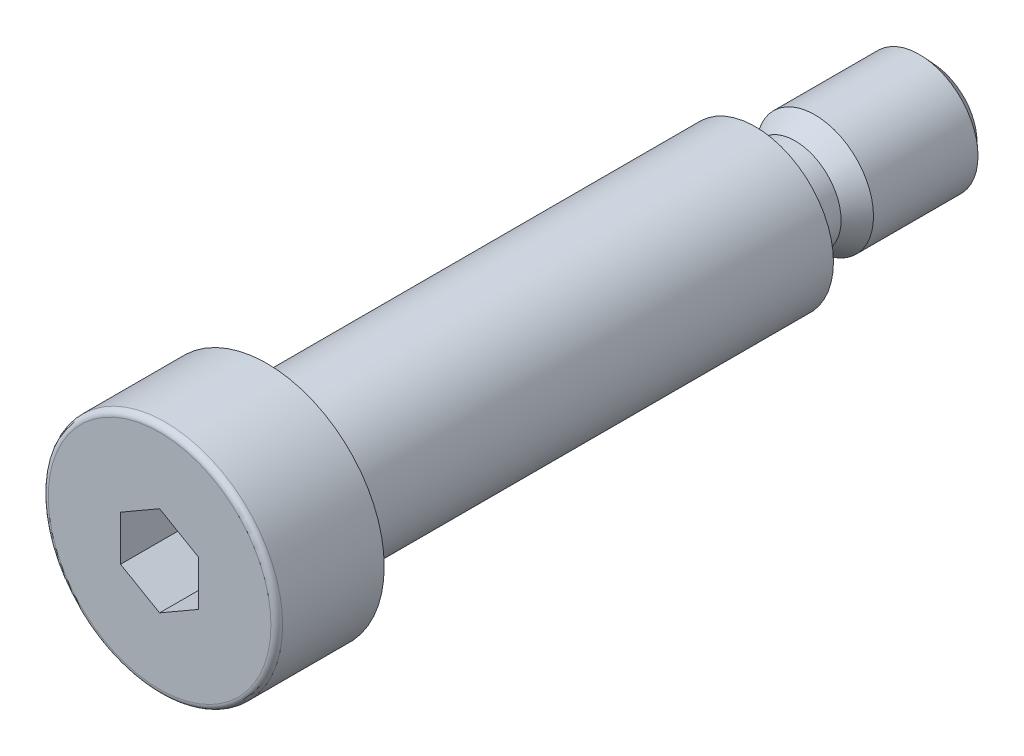
from build123d import *

# Parameters (mm, degrees)
WYTNIJ_WYCI_GNI_CIE1_DEPTH = 6.6
ZAOKR_GLENIE1_R            = 0.6


with BuildPart() as part:
    # Szkic1 → Obrót1 (revolve)
    with BuildSketch(Plane(origin=(0, 0, 0), x_dir=(1, 0, 0), z_dir=(0, 1, 0))):
        Polygon((0, 43), (-4.7, 43), (-6, 41.8), (-6, 31.1), (-4.7, 29.08), (-4.7, 25), (-8, 25), (-8, -25), (-12, -25), (-12, -36), (0, -36), align=None)
    revolve(axis=Axis((0, 0, 36), (0, 0, -1)))

    # Szkic2 → Wytnij-wyciągnięcie1 (cut)
    with BuildSketch(Plane.XY.offset(36)):
        Polygon((4, 2.309401077), (0, 4.618802154), (-4, 2.309401077), (-4, -2.309401077), (0, -4.618802154), (4, -2.309401077), align=None)
    extrude(amount=-WYTNIJ_WYCI_GNI_CIE1_DEPTH, mode=Mode.SUBTRACT)

    # Zaokrąglenie1
    zaokr_glenie1_edges = [part.edges().sort_by_distance(p)[0] for p in [
        (12, 0, 36),
    ]]
    fillet(zaokr_glenie1_edges, radius=ZAOKR_GLENIE1_R)


solid = part.part
